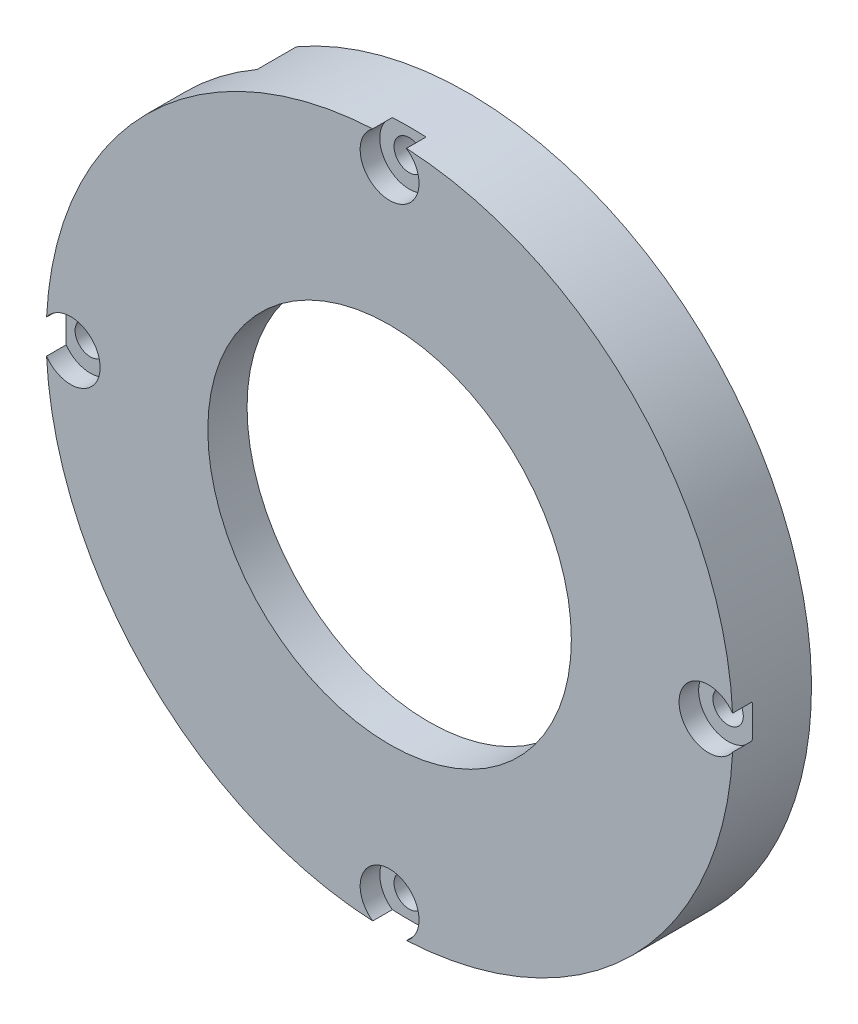
from build123d import *

# Parameters (mm, degrees)
EXTRUDE_1_OUTLINE_R   = 35
EXTRUDE_1_OUTLINE_R_2 = 1.55
EXTRUDE_1_OUTLINE_R_3 = 30.05
EXTRUDE_1_DEPTH       = 10
SKETCH_2_R            = 33.525
SKETCH_2_R_2          = 18.525
EXTRUDE_1_2_DEPTH     = 4
SKETCH_3_R            = 1.55
CUT_EXTRUDE_1_DEPTH   = 51.497524692
CUT_EXTRUDE_2_DEPTH   = 6
SKETCH_8_R            = 35
SKETCH_8_R_2          = 30.05
CUT_EXTRUDE_3_DEPTH   = 2
SKETCH_9_R            = 3
CUT_EXTRUDE_4_DEPTH   = 2


# Read off the part's stored shape, not the designer's step: 凸台-拉伸1
with BuildPart() as part:
    # Extrude 1 outline → Extrude 1 (new body)
    with BuildSketch(Plane.XY):
        Circle(EXTRUDE_1_OUTLINE_R)
        with Locations((0, -32.5)):
            Circle(EXTRUDE_1_OUTLINE_R_2, mode=Mode.SUBTRACT)
        with Locations((-32.5, 0)):
            Circle(EXTRUDE_1_OUTLINE_R_2, mode=Mode.SUBTRACT)
        Circle(EXTRUDE_1_OUTLINE_R_3, mode=Mode.SUBTRACT)
        with Locations((32.5, 0)):
            Circle(EXTRUDE_1_OUTLINE_R_2, mode=Mode.SUBTRACT)
        with Locations((0, 32.5)):
            Circle(EXTRUDE_1_OUTLINE_R_2, mode=Mode.SUBTRACT)
    extrude(amount=EXTRUDE_1_DEPTH)

    # 草图2 → Extrude 1 2 (add)
    with BuildSketch(Plane.XY.offset(10)):
        Circle(SKETCH_2_R)
        Circle(SKETCH_2_R_2, mode=Mode.SUBTRACT)
    extrude(amount=-EXTRUDE_1_2_DEPTH)

    # 草图3 → 切除-拉伸1 (cut, through all)
    with BuildSketch(Plane(origin=(0, 0, 0), x_dir=(-1, 0, 0), z_dir=(0, 0, -1))):
        with Locations(Location((32.5, 0, 0), (0, 0, 180))):
            Circle(SKETCH_3_R)
        with Locations(Location((0, -32.5, 0), (0, 0, 180))):
            Circle(SKETCH_3_R)
        with Locations(Location((-32.5, 0, 0), (0, 0, 180))):
            Circle(SKETCH_3_R)
        with Locations(Location((0, 32.5, 0), (0, 0, 180))):
            Circle(SKETCH_3_R)
    extrude(amount=-CUT_EXTRUDE_1_DEPTH, mode=Mode.SUBTRACT)

    # 草图7 → 切除-拉伸2 (cut)
    with BuildSketch(Plane(origin=(0, 0, 0), x_dir=(-1, 0, 0), z_dir=(0, 0, -1))):
        with BuildLine():
            Line((15.025, 26.024063384), (17.5, 30.310889132))
            ThreePointArc((17.5, 30.310889132), (24.748737342, 24.748737342), (30.310889132, 17.5))
            Line((30.310889132, 17.5), (26.024063384, 15.025))
            ThreePointArc((26.024063384, 15.025), (21.248558775, 21.248558775), (15.025, 26.024063384))
        make_face()
    extrude(amount=-CUT_EXTRUDE_2_DEPTH, mode=Mode.SUBTRACT)

    # 草图8 → 切除-拉伸3 (cut)
    with BuildSketch(Plane(origin=(0, 0, 0), x_dir=(-1, 0, 0), z_dir=(0, 0, -1))):
        with Locations(Location((0, 0, 0), (0, 0, 30))):
            Circle(SKETCH_8_R)
        Circle(SKETCH_8_R_2, mode=Mode.SUBTRACT)
    extrude(amount=-CUT_EXTRUDE_3_DEPTH, mode=Mode.SUBTRACT)

    # 草图9 → 切除-拉伸4 (cut)
    with BuildSketch(Plane.XY.offset(10)):
        with Locations((0, 32.5)):
            Circle(SKETCH_9_R)
        with Locations((32.5, 0)):
            Circle(SKETCH_9_R)
        with Locations((0, -32.5)):
            Circle(SKETCH_9_R)
        with Locations((-32.5, 0)):
            Circle(SKETCH_9_R)
    extrude(amount=-CUT_EXTRUDE_4_DEPTH, mode=Mode.SUBTRACT)


solid = part.part
